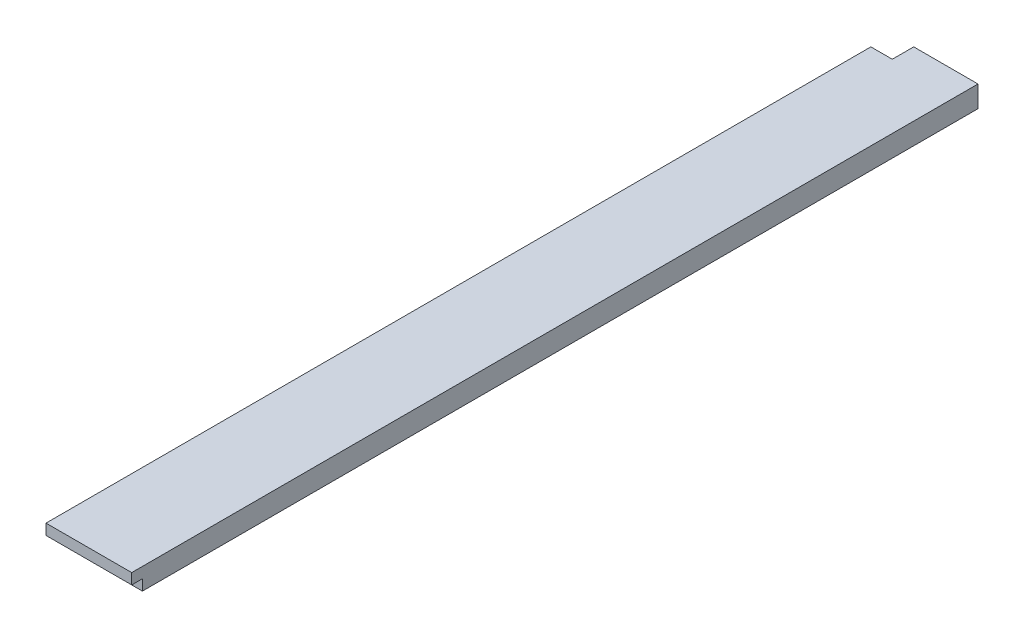
from build123d import *

# Parameters (mm, degrees)
BOSS_EXTRUDE1_DEPTH = 501.65
SKETCH2_W           = 38.1
SKETCH2_H           = 6.35
CUT_EXTRUDE1_DEPTH  = 6.35
SKETCH3_W           = 12.7
SKETCH3_H           = 12.7
CUT_EXTRUDE2_DEPTH  = 505.375507435


with BuildPart() as part:
    # Sketch1 → Boss-Extrude1 (new body)
    with BuildSketch(Plane.XY):
        Polygon((0, 12.7), (0, 6.35), (12.7, 6.35), (12.7, 0), (50.8, 0), (50.8, 12.7), align=None)
    extrude(amount=BOSS_EXTRUDE1_DEPTH)

    # Sketch2 → Cut-Extrude1 (cut)
    with BuildSketch(Plane.XZ):
        with Locations((31.75, 498.475)):
            Rectangle(SKETCH2_W, SKETCH2_H)
    extrude(amount=-CUT_EXTRUDE1_DEPTH, mode=Mode.SUBTRACT)

    # Sketch3 → Cut-Extrude2 (cut, through all)
    with BuildSketch(Plane(origin=(0, 12.7, 0), x_dir=(1, 0, 0), z_dir=(0, 1, 0))):
        with Locations((6.35, -6.35)):
            Rectangle(SKETCH3_W, SKETCH3_H)
    extrude(amount=-CUT_EXTRUDE2_DEPTH, mode=Mode.SUBTRACT)


solid = part.part
